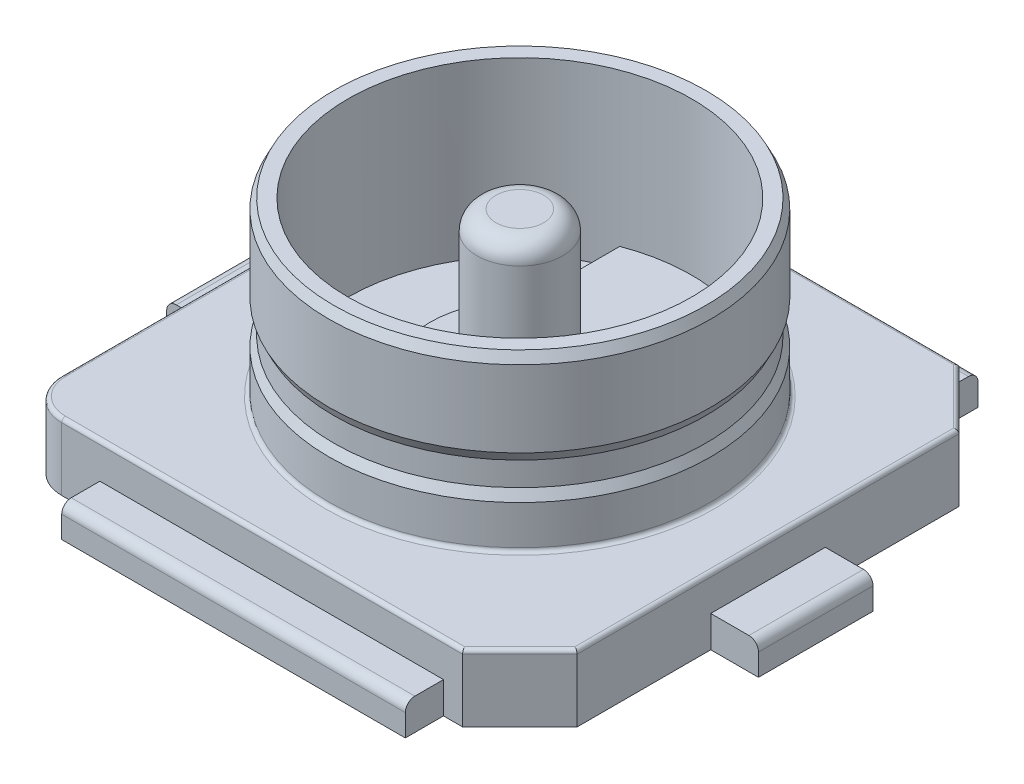
from build123d import *

# Parameters (mm, degrees)
SKETCH1_W           = 1.8
SKETCH1_H           = 0.2
SKETCH1_W_2         = 0.25
SKETCH1_H_2         = 0.6
BOSS_EXTRUDE1_DEPTH = 0.165
BOSS_EXTRUDE2_DEPTH = 0.35
SKETCH2_R           = 1
BOSS_EXTRUDE3_DEPTH = 0.225
SKETCH4_R           = 0.975
SKETCH5_R           = 0.975
SKETCH6_R           = 1
SKETCH7_R           = 1
BOSS_EXTRUDE4_DEPTH = 0.4
SKETCH8_R           = 0.975
SKETCH9_R           = 0.9
CUT_EXTRUDE1_DEPTH  = 0.9
SKETCH10_R          = 0.225
BOSS_EXTRUDE5_DEPTH = 0.85
BOSS_EXTRUDE6_DEPTH = 0.1
FILLET1_R           = 0.05
FILLET2_R           = 0.05
FILLET3_R           = 0.05
FILLET4_R           = 0.05
FILLET5_R           = 0.02
FILLET6_R           = 0.1


# Read off the part's stored shape, not the designer's step: Boss-Extrude2
with BuildPart() as part:
    # Sketch1 → Boss-Extrude1 (new body)
    with BuildSketch(Plane(origin=(0, 0, 0), x_dir=(1, 0, 0), z_dir=(0, 1, 0))):
        with Locations((1.3, -0.1)):
            Rectangle(SKETCH1_W, SKETCH1_H)
        with Locations((2.725, 1.3)):
            Rectangle(SKETCH1_W_2, SKETCH1_H_2)
        with Locations((1.3, 2.7)):
            Rectangle(SKETCH1_W, SKETCH1_H)
        with Locations((-0.125, 1.3)):
            Rectangle(SKETCH1_W_2, SKETCH1_H_2)
        with BuildLine():
            Line((2.303450249, 1), (2.6, 1))
            Line((2.6, 1), (2.6, 1.6))
            Line((2.6, 1.6), (2.303450249, 1.6))
            ThreePointArc((2.303450249, 1.6), (2.347335859, 1.3), (2.303450249, 1))
        make_face()
        with BuildLine():
            Line((2.2, 2.6), (0.4, 2.6))
            Line((0.4, 2.6), (0.4, 2.347335859))
            Line((0.4, 2.347335859), (0.963715005, 2.347335859))
            ThreePointArc((0.963715005, 2.347335859), (1.3, 2.4), (1.636284995, 2.347335859))
            Line((1.636284995, 2.347335859), (2.2, 2.347335859))
            Line((2.2, 2.347335859), (2.2, 2.6))
        make_face()
        with BuildLine():
            Line((0.4, 0.252664141), (0.4, 0))
            Line((0.4, 0), (2.2, 0))
            Line((2.2, 0), (2.2, 0.252664141))
            Line((2.2, 0.252664141), (1.636284995, 0.252664141))
            ThreePointArc((1.636284995, 0.252664141), (1.3, 0.2), (0.963715005, 0.252664141))
            Line((0.963715005, 0.252664141), (0.4, 0.252664141))
        make_face()
        with BuildLine():
            Line((0, 1.6), (0, 1))
            Line((0, 1), (0.296549751, 1))
            ThreePointArc((0.296549751, 1), (0.252664141, 1.3), (0.296549751, 1.6))
            Line((0.296549751, 1.6), (0, 1.6))
        make_face()
    extrude(amount=BOSS_EXTRUDE1_DEPTH)

    # Fillet1
    fillet1_edges = [part.edges().sort_by_distance(p)[0] for p in [
        (1.3, 0.165, -2.8),
    ]]
    fillet(fillet1_edges, radius=FILLET1_R)

    # Fillet2
    fillet2_edges = [part.edges().sort_by_distance(p)[0] for p in [
        (2.85, 0.165, -1.3),
    ]]
    fillet(fillet2_edges, radius=FILLET2_R)

    # Fillet3
    fillet3_edges = [part.edges().sort_by_distance(p)[0] for p in [
        (-0.25, 0.165, -1.3),
    ]]
    fillet(fillet3_edges, radius=FILLET3_R)

    # Fillet4
    fillet4_edges = [part.edges().sort_by_distance(p)[0] for p in [
        (1.3, 0.165, 0.2),
    ]]
    fillet(fillet4_edges, radius=FILLET4_R)


with BuildPart() as body_2:
    # Boss-Extrude2 outline → Boss-Extrude2 (new body)
    with BuildSketch(Plane(origin=(0, 0, 0), x_dir=(1, 0, 0), z_dir=(0, 1, 0))):
        with BuildLine():
            Line((0.2, 0), (2.3, 0))
            Line((2.3, 0), (2.6, 0.3))
            Line((2.6, 0.3), (2.6, 2.3))
            Line((2.6, 2.3), (2.3, 2.6))
            Line((2.3, 2.6), (0.2, 2.6))
            ThreePointArc((0.2, 2.6), (0.058578644, 2.541421356), (0, 2.4))
            Line((0, 2.4), (0, 0.2))
            ThreePointArc((0, 0.2), (0.058578644, 0.058578644), (0.2, 0))
        make_face()
    extrude(amount=BOSS_EXTRUDE2_DEPTH)

    # Sketch2 → Boss-Extrude3 (add)
    with BuildSketch(Plane(origin=(0, 0.35, 0), x_dir=(1, 0, 0), z_dir=(0, 1, 0))):
        with Locations(Location((1.3, 1.3, 0), (0, 0, 270))):
            Circle(SKETCH2_R)
    extrude(amount=BOSS_EXTRUDE3_DEPTH)

    # Sketch4 → section 1 of loft1
    with BuildSketch(Plane(origin=(0, 0.625, 0), x_dir=(1, 0, 0), z_dir=(0, 1, 0)), mode=Mode.PRIVATE) as loft1_s1:
        with Locations((1.3, 1.3)):
            Circle(SKETCH4_R)
    # loft up to a face of the part (loft1)
    loft([Face(Wire([body_2.edges().sort_by_distance((2.028968627, 0.575, -1.984547106))[0]])), loft1_s1.sketch])

    # Sketch5 → section 0 of loft2
    with BuildSketch(Plane(origin=(0, 0.75, 0), x_dir=(1, 0, 0), z_dir=(0, 1, 0)), mode=Mode.PRIVATE) as loft2_s0:
        with Locations((1.3, 1.3)):
            Circle(SKETCH5_R)
    # loft up to a face of the part (loft2)
    loft([loft2_s0.sketch, Face(Wire([body_2.edges().sort_by_distance((2.010744412, 0.625, -1.967433428))[0]]))])

    # Sketch6 → section 1 of loft3
    with BuildSketch(Plane(origin=(0, 0.8, 0), x_dir=(1, 0, 0), z_dir=(0, 1, 0)), mode=Mode.PRIVATE) as loft3_s1:
        with Locations((1.3, 1.3)):
            Circle(SKETCH6_R)
    # loft up to a face of the part (loft3)
    loft([Face(Wire([body_2.edges().sort_by_distance((0.632566572, 0.75, -2.010744412))[0]])), loft3_s1.sketch])

    # Sketch7 → Boss-Extrude4 (add)
    with BuildSketch(Plane(origin=(0, 0.8, 0), x_dir=(1, 0, 0), z_dir=(0, 1, 0))):
        with Locations(Location((1.3, 1.3, 0), (0, 0, 270))):
            Circle(SKETCH7_R)
    extrude(amount=BOSS_EXTRUDE4_DEPTH)

    # Sketch8 → section 1 of loft5
    with BuildSketch(Plane(origin=(0, 1.25, 0), x_dir=(1, 0, 0), z_dir=(0, 1, 0)), mode=Mode.PRIVATE) as loft5_s1:
        with Locations((1.3, 1.3)):
            Circle(SKETCH8_R)
    # loft up to a face of the part (loft5)
    loft([Face(Wire([body_2.edges().sort_by_distance((2.028968627, 1.2, -1.984547106))[0]])), loft5_s1.sketch])

    # Sketch9 → Cut-Extrude1 (cut)
    with BuildSketch(Plane(origin=(0, 1.25, 0), x_dir=(1, 0, 0), z_dir=(0, 1, 0))):
        with Locations(Location((1.3, 1.3, 0), (0, 0, 270))):
            Circle(SKETCH9_R)
    extrude(amount=-CUT_EXTRUDE1_DEPTH, mode=Mode.SUBTRACT)

    # Sketch10 → Boss-Extrude5 (add)
    with BuildSketch(Plane(origin=(0, 0.35, 0), x_dir=(1, 0, 0), z_dir=(0, 1, 0))):
        with Locations(Location((1.3, 1.3, 0), (0, 0, 270))):
            Circle(SKETCH10_R)
    extrude(amount=BOSS_EXTRUDE5_DEPTH)

    # Sketch11 → Boss-Extrude6 (add)
    with BuildSketch(Plane(origin=(0, 0.35, 0), x_dir=(1, 0, 0), z_dir=(0, 1, 0))):
        with BuildLine():
            Line((1.618502888, 0.952098493), (1.618502888, 0.458242368))
            ThreePointArc((1.618502888, 0.458242368), (1.3, 0.4), (0.981497112, 0.458242368))
            Line((0.981497112, 0.458242368), (0.981497112, 0.952098493))
            ThreePointArc((0.981497112, 0.952098493), (0.828322623, 1.3), (0.981497112, 1.647901507))
            Line((0.981497112, 1.647901507), (0.981497112, 2.141757632))
            ThreePointArc((0.981497112, 2.141757632), (1.3, 2.2), (1.618502888, 2.141757632))
            Line((1.618502888, 2.141757632), (1.618502888, 1.647901507))
            ThreePointArc((1.618502888, 1.647901507), (1.771677377, 1.3), (1.618502888, 0.952098493))
        make_face()
    extrude(amount=BOSS_EXTRUDE6_DEPTH)

    # Fillet5
    fillet5_edges = [body_2.edges().sort_by_distance(p)[0] for p in [
        (2.45, 0.35, -0.15),
        (2.6, 0.35, -1.3),
        (2.45, 0.35, -2.45),
        (1.25, 0.35, -2.6),
        (0.058578644, 0.35, -2.541421356),
        (1.3, 0.35, -2.3),
        (1.25, 0.35, 0),
        (0, 0.35, -1.3),
        (0.058578644, 0.35, -0.058578644),
    ]]
    fillet(fillet5_edges, radius=FILLET5_R)

    # Fillet6
    fillet6_edges = [body_2.edges().sort_by_distance(p)[0] for p in [
        (1.3, 1.2, -1.525),
    ]]
    fillet(fillet6_edges, radius=FILLET6_R)


solid = Compound([part.part, body_2.part])
